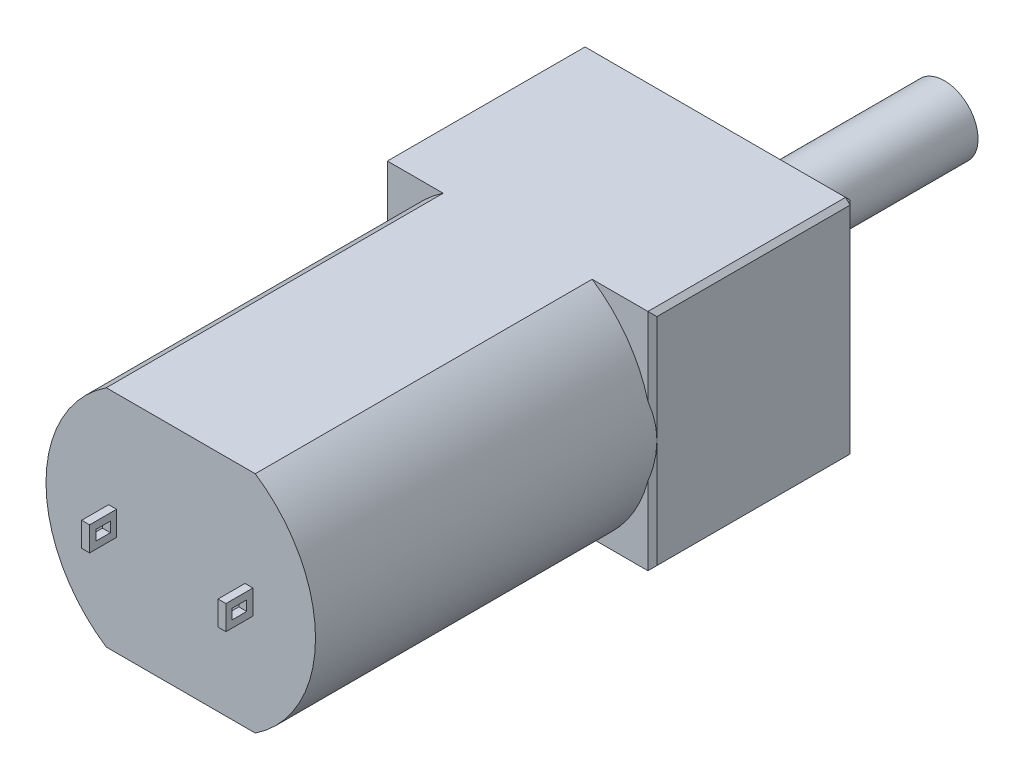
from build123d import *

# Parameters (mm, degrees)
SKETCH_1_W          = 12
SKETCH_1_H          = 10
EXTRUDE_2_DEPTH     = 9
EXTRUDE_4_DEPTH     = 15
CHAMFER_4_SIZE      = 0.2
SKETCH_4_W          = 0.352238381
SKETCH_4_H          = 1.084523436
EXTRUDE_5_DEPTH     = 1.2
SKETCH_5_W          = 0.65
SKETCH_5_H          = 0.45
CUT_EXTRUDE_1_DEPTH = 28.29282553
SKETCH_6_R          = 1.5
EXTRUDE_6_DEPTH     = 10


with BuildPart() as part:
    # 草图1 → 凸台-拉伸2 (new body)
    with BuildSketch(Plane.XY):
        Rectangle(SKETCH_1_W, SKETCH_1_H)
    extrude(amount=EXTRUDE_2_DEPTH)

    # 草图2 → 凸台-拉伸4 (add)
    with BuildSketch(Plane.XY.offset(9)):
        with BuildLine():
            Line((-3.31662479, 5), (3.31662479, 5))
            ThreePointArc((3.31662479, 5), (6, 0), (3.31662479, -5))
            Line((3.31662479, -5), (-3.31662479, -5))
            ThreePointArc((-3.31662479, -5), (-6, 0), (-3.31662479, 5))
        make_face()
    extrude(amount=EXTRUDE_4_DEPTH)

    # 倒角4
    # the kernel refuses this chamfer: 0.2 mm, written as the material it takes off along each edge
    with BuildSketch(Plane(origin=(-5.866666667, -4.866666667, 0.133333333), x_dir=(-0.7071067811865491, 0.707106781186546, 0), z_dir=(-0.577350269189624, -0.5773502691896265, -0.5773502691896268)), Plane(origin=(5.866666667, 4.866666667, 0.133333333), x_dir=(-0.7071067811865478, -3.1401849173675483e-15, -0.7071067811865472), z_dir=(0.577350269189624, 0.5773502691896265, -0.577350269189627))) as chamfer_4_piece_1:
        Polygon((-0.141421356, -0.081649658), (0.141421356, -0.081649658), (0, 0.163299316), align=None)
    extrude(amount=0.254034118, mode=Mode.SUBTRACT)
    with BuildSketch(Plane(origin=(5.866666667, -4.866666667, 0.133333333), x_dir=(0.707106781186546, 0.7071067811865491, 0), z_dir=(0.5773502691896265, -0.577350269189624, -0.577350269189627)), Plane(origin=(-5.866666667, 4.866666667, 0.133333333), x_dir=(0.7071067811865478, 0, -0.7071067811865472), z_dir=(-0.5773502691896265, 0.577350269189624, -0.5773502691896268))) as chamfer_4_piece_2:
        Polygon((-0.141421356, 0.081649658), (0.141421356, 0.081649658), (0, -0.163299316), align=None)
    extrude(amount=0.254034118, mode=Mode.SUBTRACT)
    with BuildSketch(Plane(origin=(-6, 5.514336598, 9), x_dir=(-0.02749587661058742, 0, -0.9996219169112966), z_dir=(0, -1, 0))) as chamfer_4_piece_3_section:
        Polygon((CHAMFER_4_SIZE * 0.999621916911, CHAMFER_4_SIZE * 0.0274958766106), (-CHAMFER_4_SIZE * 0.0274958766106, CHAMFER_4_SIZE * 0.999621916911), (0, 0), align=None)
    chamfer_4_piece_3 = extrude(amount=5.514336598, mode=Mode.PRIVATE)
    chamfer_4_piece_3 = chamfer_4_piece_3 - Plane(origin=(0, 0, 8.93146509), x_dir=(-0.5527707983925667, -0.8333333333333334, 0), z_dir=(0, 0, -1)) * Cylinder(6, 12, mode=Mode.PRIVATE)
    add(chamfer_4_piece_3, mode=Mode.SUBTRACT)
    with BuildSketch(Plane(origin=(6, 0, 9), x_dir=(0.02749587661058742, 0, -0.9996219169112966), z_dir=(0, 1, 0))) as chamfer_4_piece_4_section:
        Polygon((CHAMFER_4_SIZE * 0.999621916911, CHAMFER_4_SIZE * 0.0274958766106), (-CHAMFER_4_SIZE * 0.0274958766106, CHAMFER_4_SIZE * 0.999621916911), (0, 0), align=None)
    chamfer_4_piece_4 = extrude(amount=5.514336598, mode=Mode.PRIVATE)
    chamfer_4_piece_4 = chamfer_4_piece_4 - Plane(origin=(0, 0, 8.931465093), x_dir=(0.5527707983925666, 0.8333333333333334, 0), z_dir=(0, 0, -1)) * Cylinder(6, 12, mode=Mode.PRIVATE)
    add(chamfer_4_piece_4, mode=Mode.SUBTRACT)
    with BuildSketch(Plane(origin=(-6, 0, 9), x_dir=(-0.02749587661058742, 0, -0.9996219169112966), z_dir=(0, -1, 0))) as chamfer_4_piece_5_section:
        Polygon((CHAMFER_4_SIZE * 0.999621916911, CHAMFER_4_SIZE * 0.0274958766106), (-CHAMFER_4_SIZE * 0.0274958766106, CHAMFER_4_SIZE * 0.999621916911), (0, 0), align=None)
    chamfer_4_piece_5 = extrude(amount=5.514336598, mode=Mode.PRIVATE)
    chamfer_4_piece_5 = chamfer_4_piece_5 - Plane(origin=(0, 0, 8.931465093), x_dir=(-0.5527707983925667, -0.8333333333333334, 0), z_dir=(0, 0, -1)) * Cylinder(6, 12, mode=Mode.PRIVATE)
    add(chamfer_4_piece_5, mode=Mode.SUBTRACT)
    with BuildSketch(Plane(origin=(6, -5.514336598, 9), x_dir=(0.02749587661058742, 0, -0.9996219169112966), z_dir=(0, 1, 0))) as chamfer_4_piece_6_section:
        Polygon((CHAMFER_4_SIZE * 0.999621916911, CHAMFER_4_SIZE * 0.0274958766106), (-CHAMFER_4_SIZE * 0.0274958766106, CHAMFER_4_SIZE * 0.999621916911), (0, 0), align=None)
    chamfer_4_piece_6 = extrude(amount=5.514336598, mode=Mode.PRIVATE)
    chamfer_4_piece_6 = chamfer_4_piece_6 - Plane(origin=(0, 0, 8.93146509), x_dir=(0.5527707983925666, 0.8333333333333334, 0), z_dir=(0, 0, -1)) * Cylinder(6, 12, mode=Mode.PRIVATE)
    add(chamfer_4_piece_6, mode=Mode.SUBTRACT)
    with BuildSketch(Plane(origin=(-6.514336598, -5, 0), x_dir=(0, -0.02749587661058735, 0.9996219169112966), z_dir=(1, 0, 0))) as chamfer_4_piece_7:
        Polygon((CHAMFER_4_SIZE * 0.999621916911, -CHAMFER_4_SIZE * 0.0274958766106), (-CHAMFER_4_SIZE * 0.0274958766106, -CHAMFER_4_SIZE * 0.999621916911), (0, 0), align=None)
    extrude(amount=13.028673195, mode=Mode.SUBTRACT)
    with BuildSketch(Plane(origin=(-6, 5.514336598, 0), x_dir=(-0.02749587661058735, 0, 0.9996219169112966), z_dir=(0, -1, 0)), Plane(origin=(6, -5.514336598, 0), x_dir=(0.02749587661058735, 0, 0.9996219169112966), z_dir=(0, 1, 0))) as chamfer_4_piece_8:
        Polygon((CHAMFER_4_SIZE * 0.999621916911, -CHAMFER_4_SIZE * 0.0274958766106), (-CHAMFER_4_SIZE * 0.0274958766106, -CHAMFER_4_SIZE * 0.999621916911), (0, 0), align=None)
    extrude(amount=11.028673195, mode=Mode.SUBTRACT)
    with BuildSketch(Plane(origin=(6.514336598, 5, 0), x_dir=(0, -0.9996219169112968, -0.027495876610586313), z_dir=(-1, 0, 0))) as chamfer_4_piece_9:
        Polygon((CHAMFER_4_SIZE * 0.999621916911, CHAMFER_4_SIZE * 0.0274958766106), (-CHAMFER_4_SIZE * 0.0274958766106, CHAMFER_4_SIZE * 0.999621916911), (0, 0), align=None)
    extrude(amount=13.028673195, mode=Mode.SUBTRACT)
    with BuildSketch(Plane(origin=(6, -5, -0.514336598), x_dir=(-0.9996219169112966, -0.02749587661058742, 0), z_dir=(0, 0, 1)), Plane(origin=(6, 5, -0.514336598), x_dir=(0.02749587661058742, -0.9996219169112966, 0), z_dir=(0, 0, 1))) as chamfer_4_piece_10:
        Polygon((CHAMFER_4_SIZE * 0.999621916911, -CHAMFER_4_SIZE * 0.0274958766106), (-CHAMFER_4_SIZE * 0.0274958766106, -CHAMFER_4_SIZE * 0.999621916911), (0, 0), align=None)
    extrude(amount=10.028673195, mode=Mode.SUBTRACT)
    with BuildSketch(Plane(origin=(-6, -5, -0.514336598), x_dir=(0.9996219169112966, -0.027495876610587302, 0), z_dir=(0, 0, 1)), Plane(origin=(-6, 5, -0.514336598), x_dir=(-0.027495876610587302, -0.9996219169112966, 0), z_dir=(0, 0, 1))) as chamfer_4_piece_11:
        Polygon((CHAMFER_4_SIZE * 0.999621916911, CHAMFER_4_SIZE * 0.0274958766106), (-CHAMFER_4_SIZE * 0.0274958766106, CHAMFER_4_SIZE * 0.999621916911), (0, 0), align=None)
    extrude(amount=10.028673195, mode=Mode.SUBTRACT)

    # 草图4 → 凸台-拉伸5 (add)
    with BuildSketch(Plane.XY.offset(24)):
        with Locations((-3.035738681, 0)):
            Rectangle(SKETCH_4_W, SKETCH_4_H)
        with Locations((3.035738681, 0)):
            Rectangle(SKETCH_4_W, SKETCH_4_H)
    extrude(amount=EXTRUDE_5_DEPTH)

    # 草图5 → 切除-拉伸1 (cut, through all)
    with BuildSketch(Plane(origin=(3.211857871, 0, 0), x_dir=(0, 0, -1), z_dir=(1, 0, 0))):
        with Locations((-24.6, 0)):
            Rectangle(SKETCH_5_W, SKETCH_5_H)
    extrude(amount=-CUT_EXTRUDE_1_DEPTH, mode=Mode.SUBTRACT)

    # 草图6 → 凸台-拉伸6 (add)
    with BuildSketch(Plane(origin=(0, 0, 0), x_dir=(-1, 0, 0), z_dir=(0, 0, -1))):
        Circle(SKETCH_6_R)
    extrude(amount=EXTRUDE_6_DEPTH)


solid = part.part
